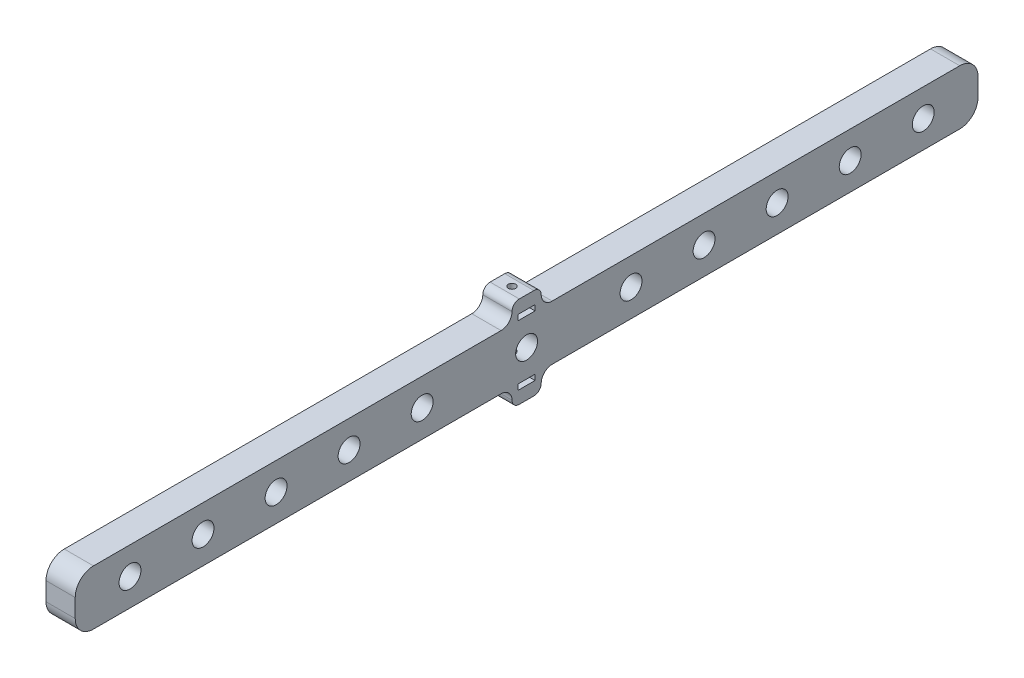
from build123d import *

# Parameters (mm, degrees)
SKETCH_1_W                = 130
SKETCH_1_H                = 15
EXTRUDE_1_DEPTH           = 8
CUT_EXTRUDE_10_REACH      = 133.107
SKETCH_17_R               = 3
SKETCH_19_W               = 8
SKETCH_19_H               = 15
EXTRUDE_6_DEPTH           = 117.2
FILLET_1_R                = 5
CUT_EXTRUDE_12_REACH      = 133.107
SKETCH_15_R               = 3
SKETCH_22_W               = 8
SKETCH_22_H               = 8
EXTRUDE_7_DEPTH           = 5
CUT_EXTRUDE_18_DEPTH      = 1.5
SKETCH_25_W               = 4.62
SKETCH_25_H               = 1.5
CUT_EXTRUDE_19_DEPTH      = 4
FILLET_8_R                = 3
FILLET_9_R                = 2
FILLET_10_R               = 2
FILLET_11_R               = 3
CUT_EXTRUDE_20_DEPTH      = 15.5
CUT_EXTRUDE_20_DEPTH_BACK = 28.5
SKETCH_21_R               = 1


with BuildPart() as part:
    # 草图1 → 凸台-拉伸1 (new body)
    with BuildSketch(Plane(origin=(0, 0, 0), x_dir=(0, 0, -1), z_dir=(1, 0, 0))):
        with Locations((65, 7.5)):
            Rectangle(SKETCH_1_W, SKETCH_1_H)
    extrude(amount=EXTRUDE_1_DEPTH)

    # 草图17 → 切除-拉伸10 (cut, up to next)
    with BuildSketch(Plane.ZY, mode=Mode.PRIVATE) as cut_extrude_10_sk1:
        with Locations((-115, 7.5)):
            Circle(SKETCH_17_R)
    cut_extrude_10_tool1 = extrude(cut_extrude_10_sk1.sketch, amount=-CUT_EXTRUDE_10_REACH, mode=Mode.PRIVATE) & part.part
    # 草图17 → 切除-拉伸10 (cut, up to next)
    with BuildSketch(Plane.ZY, mode=Mode.PRIVATE) as cut_extrude_10_sk2:
        with Locations((-95, 7.5)):
            Circle(SKETCH_17_R)
    cut_extrude_10_tool2 = extrude(cut_extrude_10_sk2.sketch, amount=-CUT_EXTRUDE_10_REACH, mode=Mode.PRIVATE) & part.part
    # 草图17 → 切除-拉伸10 (cut, up to next)
    with BuildSketch(Plane.ZY, mode=Mode.PRIVATE) as cut_extrude_10_sk3:
        with Locations((-75, 7.5)):
            Circle(SKETCH_17_R)
    cut_extrude_10_tool3 = extrude(cut_extrude_10_sk3.sketch, amount=-CUT_EXTRUDE_10_REACH, mode=Mode.PRIVATE) & part.part
    # 草图17 → 切除-拉伸10 (cut, up to next)
    with BuildSketch(Plane.ZY, mode=Mode.PRIVATE) as cut_extrude_10_sk4:
        with Locations((-55, 7.5)):
            Circle(SKETCH_17_R)
    cut_extrude_10_tool4 = extrude(cut_extrude_10_sk4.sketch, amount=-CUT_EXTRUDE_10_REACH, mode=Mode.PRIVATE) & part.part
    # 草图17 → 切除-拉伸10 (cut, up to next)
    with BuildSketch(Plane.ZY, mode=Mode.PRIVATE) as cut_extrude_10_sk5:
        with Locations((-35, 7.5)):
            Circle(SKETCH_17_R)
    cut_extrude_10_tool5 = extrude(cut_extrude_10_sk5.sketch, amount=-CUT_EXTRUDE_10_REACH, mode=Mode.PRIVATE) & part.part
    cut_extrude_10_1 = cut_extrude_10_tool1.solids().sort_by_distance((0, 7.5, -115))[0]
    add(cut_extrude_10_1, mode=Mode.SUBTRACT)
    cut_extrude_10_2 = cut_extrude_10_tool2.solids().sort_by_distance((0, 7.5, -95))[0]
    add(cut_extrude_10_2, mode=Mode.SUBTRACT)
    cut_extrude_10_3 = cut_extrude_10_tool3.solids().sort_by_distance((0, 7.5, -75))[0]
    add(cut_extrude_10_3, mode=Mode.SUBTRACT)
    cut_extrude_10_4 = cut_extrude_10_tool4.solids().sort_by_distance((0, 7.5, -55))[0]
    add(cut_extrude_10_4, mode=Mode.SUBTRACT)
    cut_extrude_10_5 = cut_extrude_10_tool5.solids().sort_by_distance((0, 7.5, -35))[0]
    add(cut_extrude_10_5, mode=Mode.SUBTRACT)
    cut_extrude_10 = cut_extrude_10_1 + cut_extrude_10_2 + cut_extrude_10_3 + cut_extrude_10_4 + cut_extrude_10_5  # 切除-拉伸10 as one shape, for the pattern or mirror that repeats it

    # 草图19 → 凸台-拉伸6 (add)
    with BuildSketch(Plane.XY):
        with Locations((4, 7.5)):
            Rectangle(SKETCH_19_W, SKETCH_19_H)
    extrude(amount=EXTRUDE_6_DEPTH)

    # 镜向1: 切除-拉伸10 across plane
    add(cut_extrude_10.mirror(Plane.XY.offset(-6.4)), mode=Mode.SUBTRACT)

    # 圆角1
    fillet_1_edges = [part.edges().sort_by_distance(p)[0] for p in [
        (4, 0, 117.2),
        (4, 15, 117.2),
        (4, 15, -130),
        (4, 0, -130),
    ]]
    fillet(fillet_1_edges, radius=FILLET_1_R)

    # 草图15 → 切除-拉伸12 (cut, up to next)
    with BuildSketch(Plane.ZY, mode=Mode.PRIVATE) as cut_extrude_12_sk1:
        with Locations((-6.4, 7.5)):
            Circle(SKETCH_15_R)
    cut_extrude_12_tool1 = extrude(cut_extrude_12_sk1.sketch, amount=-CUT_EXTRUDE_12_REACH, mode=Mode.PRIVATE) & part.part
    add(cut_extrude_12_tool1.solids().sort_by_distance((0, 7.5, -6.4))[0], mode=Mode.SUBTRACT)

    # 草图22 → 凸台-拉伸7 (add)
    with BuildSketch(Plane(origin=(0, 15, 0), x_dir=(1, 0, 0), z_dir=(0, 1, 0))):
        with Locations((4, 6.4)):
            Rectangle(SKETCH_22_W, SKETCH_22_H)
    extrude_7 = extrude(amount=EXTRUDE_7_DEPTH)

    # 草图24 → 切除-拉伸18 (cut)
    with BuildSketch(Plane(origin=(0, 15, 0), x_dir=(1, 0, 0), z_dir=(0, 1, 0))):
        Polygon((4, 4.090598923), (6, 5.245299462), (6, 7.554700538), (4, 8.709401077), (2, 7.554700538), (2, 5.245299462), align=None)
    cut_extrude_18 = extrude(amount=CUT_EXTRUDE_18_DEPTH, mode=Mode.SUBTRACT)

    # 草图25 → 切除-拉伸19 (cut)
    with BuildSketch(Plane(origin=(8, 0, 0), x_dir=(0, 0, -1), z_dir=(1, 0, 0))):
        with Locations((6.4, 15.75)):
            Rectangle(SKETCH_25_W, SKETCH_25_H)
    cut_extrude_19 = extrude(amount=-CUT_EXTRUDE_19_DEPTH, mode=Mode.SUBTRACT)

    # 圆角8
    fillet_8_edges = [part.edges().sort_by_distance(p)[0] for p in [
        (4, 15, -2.4),
        (4, 15, -10.4),
    ]]
    fillet(fillet_8_edges, radius=FILLET_8_R)

    # 圆角9
    fillet_9_edges = [part.edges().sort_by_distance(p)[0] for p in [
        (4, 20, -2.4),
        (4, 20, -10.4),
    ]]
    fillet(fillet_9_edges, radius=FILLET_9_R - 0.0001)  # a hair under: the kernel refuses the full size

    # 镜向6: 凸台-拉伸7, 切除-拉伸18, 切除-拉伸19 across plane
    add(extrude_7.mirror(Plane.ZX.offset(7.5)))
    add(cut_extrude_18.mirror(Plane.ZX.offset(7.5)), mode=Mode.SUBTRACT)
    add(cut_extrude_19.mirror(Plane.ZX.offset(7.5)), mode=Mode.SUBTRACT)

    # 圆角10
    fillet_10_edges = [part.edges().sort_by_distance(p)[0] for p in [
        (4, -5, -10.4),
        (4, -5, -2.4),
    ]]
    fillet(fillet_10_edges, radius=FILLET_10_R)

    # 圆角11
    fillet_11_edges = [part.edges().sort_by_distance(p)[0] for p in [
        (4, 0, -2.4),
        (4, 0, -10.4),
    ]]
    fillet(fillet_11_edges, radius=FILLET_11_R - 0.0001)  # a hair under: the kernel refuses the full size

    # 草图21 → 切除-拉伸20 (cut, two sides: drawn at the far end of the back side and taken through both)
    with BuildSketch(Plane(origin=(0, 15, 0), x_dir=(1, 0, 0), z_dir=(0, 1, 0)).offset(-CUT_EXTRUDE_20_DEPTH_BACK)):
        with Locations(Location((4, 6.4, 0), (0, 0, 90))):
            Circle(SKETCH_21_R)
    extrude(amount=CUT_EXTRUDE_20_DEPTH + CUT_EXTRUDE_20_DEPTH_BACK, mode=Mode.SUBTRACT)


solid = part.part
